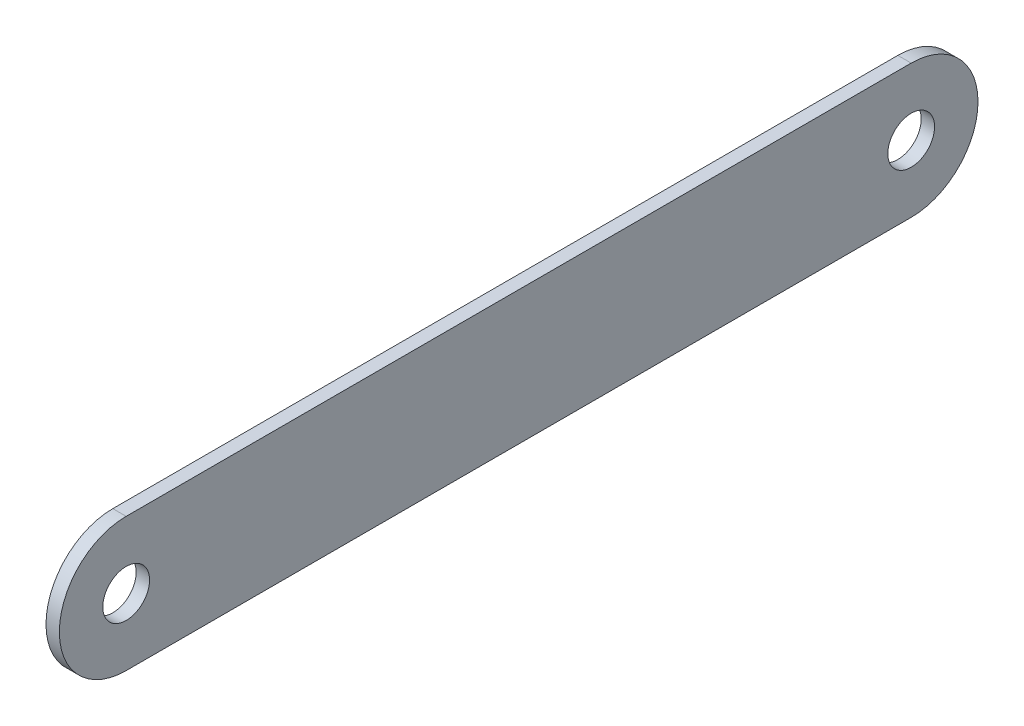
from build123d import *

# Parameters (mm, degrees)
SKETCH_1_R             = 7
SM_BASE_FLANGE_1_DEPTH = 4


# Sheet-metal steps are written as plain solids
with BuildPart() as part:
    # Sketch 1 → Базовая кромка1 (new body)
    with BuildSketch(Plane(origin=(0, 0, 0), x_dir=(0, 0, -1), z_dir=(1, 0, 0))):
        with BuildLine():
            Line((0, 20), (235, 20))
            ThreePointArc((235, 20), (255, 0), (235, -20))
            Line((235, -20), (0, -20))
            ThreePointArc((0, -20), (-20, 0), (0, 20))
        make_face()
        Circle(SKETCH_1_R, mode=Mode.SUBTRACT)
        with Locations((235, 0)):
            Circle(SKETCH_1_R, mode=Mode.SUBTRACT)
    extrude(amount=-SM_BASE_FLANGE_1_DEPTH)


solid = part.part
